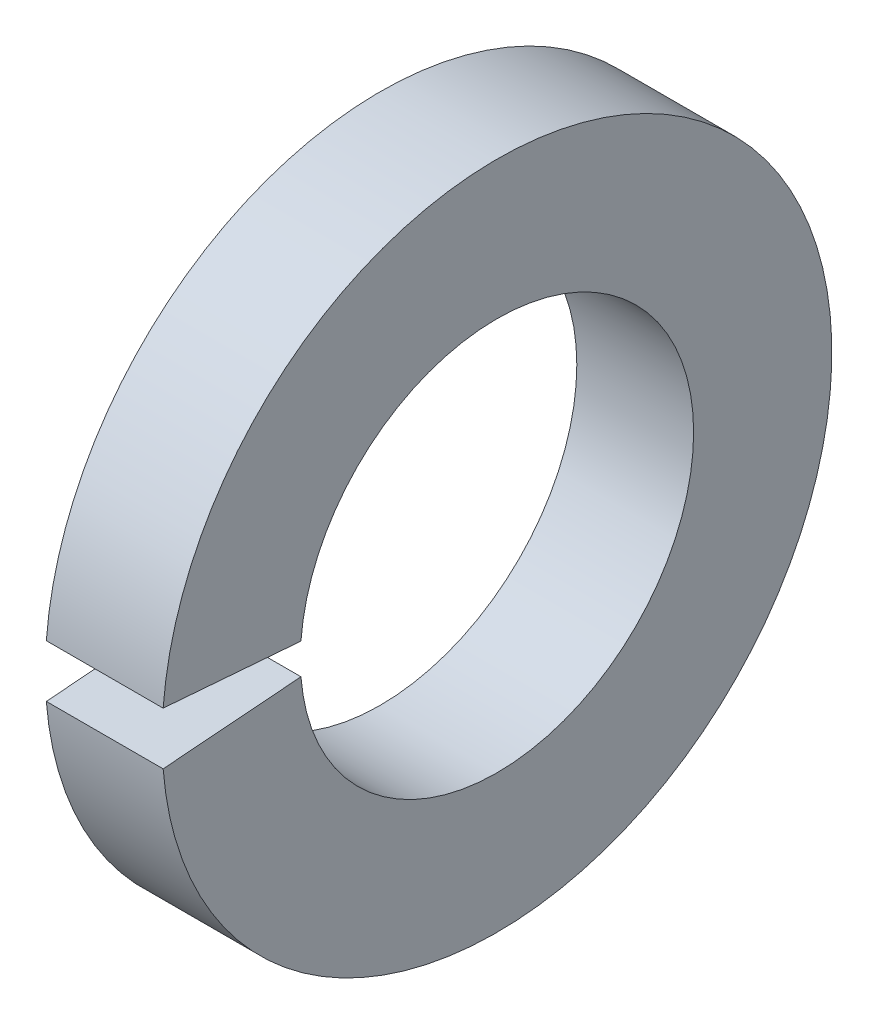
from build123d import *

# Parameters (mm, degrees)
SKETCH1_W = 6
SKETCH1_H = 7.1
GAP_DEPTH = 26.053542664


with BuildPart() as part:
    # Sketch1 → Base-Revolve (revolve)
    with BuildSketch(Plane.XY):
        with Locations((-3, 13.65)):
            Rectangle(SKETCH1_W, SKETCH1_H)
    revolve(axis=Axis((-34.925, 0, 0), (1, 0, 0)))

    # Sketch2 → Gap (cut, through all)
    with BuildSketch(Plane(origin=(0, 0, 0), x_dir=(0, -1, 0), z_dir=(-1, 0, 0))):
        with BuildLine():
            Line((0, 0), (1.376486375, 17.489917703))
            ThreePointArc((1.376486375, 17.489917703), (0, 17.544), (-1.376486375, 17.489917703))
            Line((-1.376486375, 17.489917703), (0, 0))
        make_face()
    extrude(amount=GAP_DEPTH, mode=Mode.SUBTRACT)


solid = part.part
